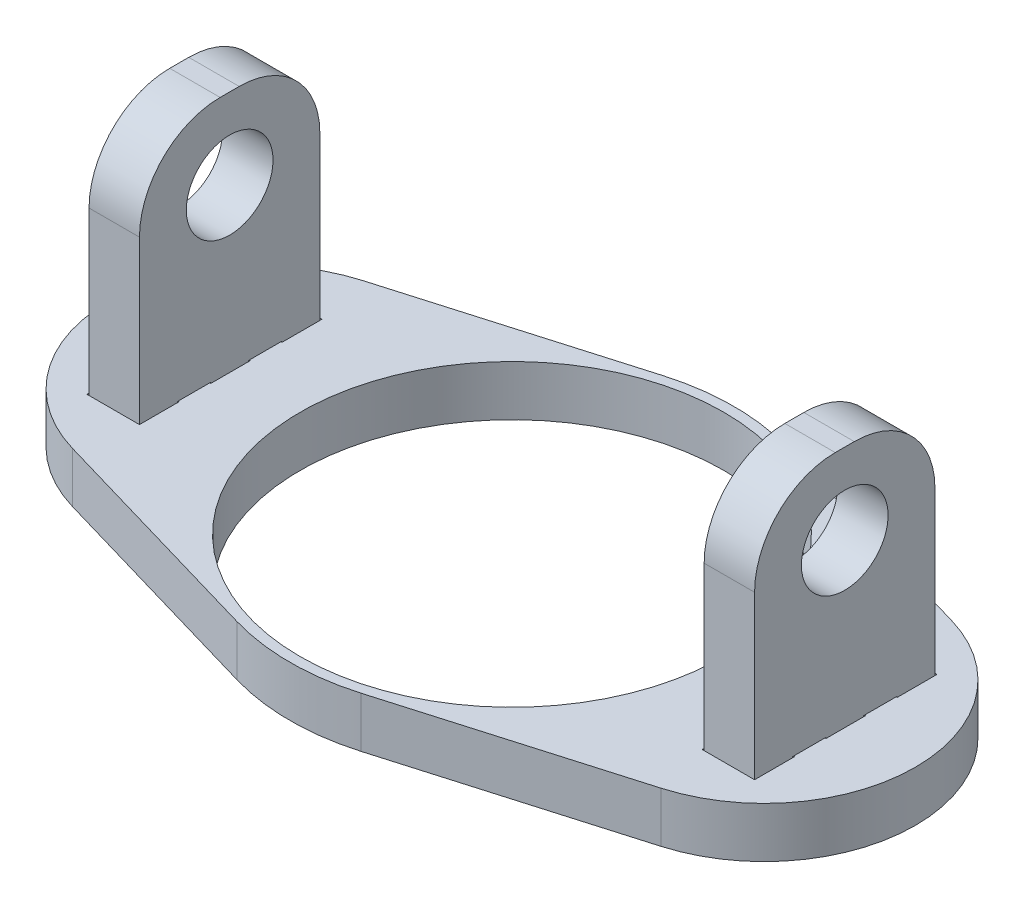
from build123d import *

# Parameters (mm, degrees)
SKETCH1_R                    = 10.5
BOSS_EXTRUDE1_DEPTH          = 2.5
SKETCH2_W                    = 2.5
SKETCH2_H                    = 8.94427191
BOSS_EXTRUDE2_DEPTH          = 12
SKETCH5_W                    = 2.15
SKETCH5_H                    = 36.5
FILLET1_R                    = 4
TAB_START                    = -16.5
TAB_AND_SLOT_TAB1_OUTLINE_W  = 2.5
TAB_AND_SLOT_TAB1_OUTLINE_H  = 1.874
TAB_AND_SLOT_TAB1_DEPTH      = 2.5
TAB_START_2                  = -16.55
TAB_AND_SLOT_SLOT1_OUTLINE_W = 2.5
TAB_AND_SLOT_SLOT1_OUTLINE_H = 1.974
TAB_AND_SLOT_SLOT1_DEPTH     = 2.6


# Read off the part's stored shape, not the designer's step: Tab and Slot-Tab1, Tab and Slot-Slot1
with BuildPart() as part:
    # Sketch1 → Boss-Extrude1 (new body)
    with BuildSketch(Plane(origin=(0, 0, 0), x_dir=(1, 0, 0), z_dir=(0, 1, 0))):
        with BuildLine():
            Line((14.6, 7.2), (3.08, 10.56))
            ThreePointArc((3.08, 10.56), (0, 11), (-3.08, 10.56))
            Line((-3.08, 10.56), (-14.6, 7.2))
            ThreePointArc((-14.6, 7.2), (-20, 0), (-14.6, -7.2))
            Line((-14.6, -7.2), (-3.08, -10.56))
            ThreePointArc((-3.08, -10.56), (0, -11), (3.08, -10.56))
            Line((3.08, -10.56), (14.6, -7.2))
            ThreePointArc((14.6, -7.2), (20, 0), (14.6, 7.2))
        make_face()
        with Locations(Location((0, 0, 0), (0, 0, 270))):
            Circle(SKETCH1_R, mode=Mode.SUBTRACT)
    extrude(amount=BOSS_EXTRUDE1_DEPTH)

    # Tab and Slot-Slot1 outline → Tab and Slot-Slot1 (cut)
    with BuildSketch(Plane.YZ.offset(TAB_START_2)):
        with Locations((1.25, 3.535135955)):
            Rectangle(TAB_AND_SLOT_SLOT1_OUTLINE_W, TAB_AND_SLOT_SLOT1_OUTLINE_H)
        with Locations((1.25, 0)):
            Rectangle(TAB_AND_SLOT_SLOT1_OUTLINE_W, TAB_AND_SLOT_SLOT1_OUTLINE_H)
        with Locations((1.25, -3.535135955)):
            Rectangle(TAB_AND_SLOT_SLOT1_OUTLINE_W, TAB_AND_SLOT_SLOT1_OUTLINE_H)
    tab_and_slot_slot1 = extrude(amount=TAB_AND_SLOT_SLOT1_DEPTH, mode=Mode.SUBTRACT)

    # Mirror1: Tab and Slot-Slot1 across plane
    add(tab_and_slot_slot1.mirror(Plane(origin=(0, 0, 0), x_dir=(0, 0, 1), z_dir=(1, 0, 0))), mode=Mode.SUBTRACT)


with BuildPart() as body_2:
    # Sketch2 → Boss-Extrude2 (new body)
    with BuildSketch(Plane(origin=(0, 2.5, 0), x_dir=(1, 0, 0), z_dir=(0, 1, 0))):
        with Locations((-15.25, 0)):
            Rectangle(SKETCH2_W, SKETCH2_H)
    extrude(amount=BOSS_EXTRUDE2_DEPTH)

    # Sketch5 → M4 Clearance Hole1 (revolve, cut)
    with BuildSketch(Plane(origin=(-16.5, 10.5, 0), x_dir=(0, 0, 1), z_dir=(0, 1, 0))):
        with Locations((1.075, 18.25)):
            Rectangle(SKETCH5_W, SKETCH5_H)
    revolve(axis=Axis((-22.85, 10.5, 0), (1, 0, 0)), mode=Mode.SUBTRACT)

    # Fillet1
    fillet1_edges = [body_2.edges().sort_by_distance(p)[0] for p in [
        (-15.25, 14.5, -4.472135955),
        (-15.25, 14.5, 4.472135955),
    ]]
    fillet(fillet1_edges, radius=FILLET1_R)

    # Tab and Slot-Tab1 outline → Tab and Slot-Tab1 (add)
    with BuildSketch(Plane.YZ.offset(TAB_START)):
        with Locations((1.25, -3.535135955)):
            Rectangle(TAB_AND_SLOT_TAB1_OUTLINE_W, TAB_AND_SLOT_TAB1_OUTLINE_H)
        with Locations((1.25, 3.535135955)):
            Rectangle(TAB_AND_SLOT_TAB1_OUTLINE_W, TAB_AND_SLOT_TAB1_OUTLINE_H)
        with Locations((1.25, 0)):
            Rectangle(TAB_AND_SLOT_TAB1_OUTLINE_W, TAB_AND_SLOT_TAB1_OUTLINE_H)
    extrude(amount=TAB_AND_SLOT_TAB1_DEPTH)


with BuildPart() as body_3:
    # Mirror2: mirrored copy
    add(body_2.part.mirror(Plane(origin=(0, 0, 0), x_dir=(0, 0, 1), z_dir=(1, 0, 0))))


solid = Compound([part.part, body_2.part, body_3.part])
